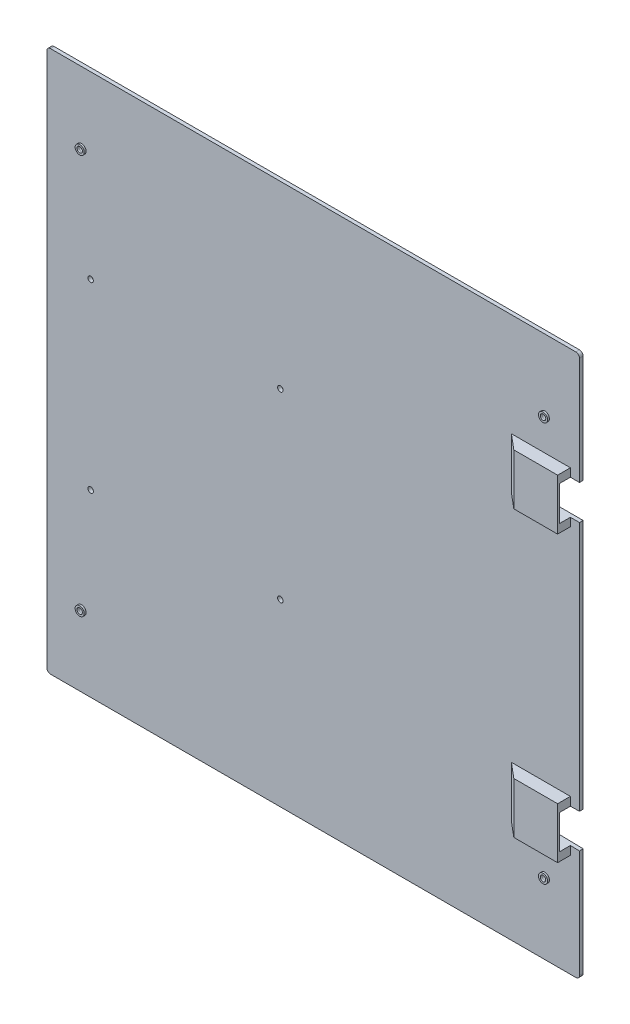
from build123d import *

# Parameters (mm, degrees)
BOSS_EXTRUDE1_DEPTH = 2
SKETCH4_R           = 1.6
CUT_EXTRUDE4_DEPTH  = 414.677410551
SKETCH3_R           = 2.5
SKETCH3_R_2         = 1.5
BOSS_EXTRUDE3_DEPTH = 1
SKETCH5_W           = 24
SKETCH5_H           = 28
BOSS_EXTRUDE2_DEPTH = 7
SKETCH2_W           = 19
SKETCH2_H           = 24.51763809
CUT_EXTRUDE5_DEPTH  = 9
BOSS_EXTRUDE4_REACH = 375.267
SKETCH8_W           = 28
SKETCH8_H           = 24
SKETCH9_R           = 1.5
CUT_EXTRUDE7_DEPTH  = 414.770467772


with BuildPart() as part:
    # Sketch1 → Boss-Extrude1 (new body)
    with BuildSketch(Plane.XY):
        with BuildLine():
            Line((0, 2), (288, 2))
            ThreePointArc((288, 2), (289.414213562, 1.414213562), (290, 0))
            Line((290, 0), (290, -293))
            ThreePointArc((290, -293), (289.414213562, -294.414213562), (288, -295))
            Line((288, -295), (0, -295))
            ThreePointArc((0, -295), (-1.414213562, -294.414213562), (-2, -293))
            Line((-2, -293), (-2, 0))
            ThreePointArc((-2, 0), (-1.414213562, 1.414213562), (0, 2))
        make_face()
    extrude(amount=BOSS_EXTRUDE1_DEPTH)

    # Sketch4 → Cut-Extrude4 (cut, through all)
    with BuildSketch(Plane(origin=(0, 0, 0), x_dir=(-1, 0, 0), z_dir=(0, 0, -1))):
        with Locations((-271, -256)):
            Circle(SKETCH4_R)
        with Locations(Location((-271, -37, 0), (0, 0, 180))):
            Circle(SKETCH4_R)
        with Locations(Location((-17, -256, 0), (0, 0, 180))):
            Circle(SKETCH4_R)
        with Locations((-17, -37)):
            Circle(SKETCH4_R)
    extrude(amount=-CUT_EXTRUDE4_DEPTH, mode=Mode.SUBTRACT)

    # Sketch3 → Boss-Extrude3 (add)
    # profile 1 of 4: a face of its own
    with BuildSketch(Plane(origin=(0, 0, 2), x_dir=(-1, 0, 0), z_dir=(0, 0, -1))):
        with Locations((-271, -37)):
            Circle(SKETCH3_R)
        with Locations((-271, -37)):
            Circle(SKETCH3_R_2, mode=Mode.SUBTRACT)
    # profile 2 of 4: a face of its own
    with BuildSketch(Plane(origin=(0, 0, 2), x_dir=(-1, 0, 0), z_dir=(0, 0, -1))):
        with Locations(Location((-17, -37, 0), (0, 0, 180))):
            Circle(SKETCH3_R)
        with Locations(Location((-17, -37, 0), (0, 0, 180))):
            Circle(SKETCH3_R_2, mode=Mode.SUBTRACT)
    # profile 3 of 4: a face of its own
    with BuildSketch(Plane(origin=(0, 0, 2), x_dir=(-1, 0, 0), z_dir=(0, 0, -1))):
        with Locations((-17, -256)):
            Circle(SKETCH3_R)
        with Locations((-17, -256)):
            Circle(SKETCH3_R_2, mode=Mode.SUBTRACT)
    # profile 4 of 4: a face of its own
    with BuildSketch(Plane(origin=(0, 0, 2), x_dir=(-1, 0, 0), z_dir=(0, 0, -1))):
        with Locations(Location((-271, -256, 0), (0, 0, 180))):
            Circle(SKETCH3_R)
        with Locations(Location((-271, -256, 0), (0, 0, 180))):
            Circle(SKETCH3_R_2, mode=Mode.SUBTRACT)
    extrude(amount=-BOSS_EXTRUDE3_DEPTH)

    # Sketch5 → Boss-Extrude2 (add)
    with BuildSketch(Plane.XY.offset(2)):
        with Locations((273, -68.5)):
            Rectangle(SKETCH5_W, SKETCH5_H)
        with Locations((273, -224.5)):
            Rectangle(SKETCH5_W, SKETCH5_H)
    extrude(amount=BOSS_EXTRUDE2_DEPTH)

    # Sketch2 → Cut-Extrude5 (cut)
    with BuildSketch(Plane(origin=(19.360490202, 0, -72.51763809), x_dir=(0, -1, 0), z_dir=(-0.25881904510252135, 0, 0.9659258262890681))):
        Polygon((234, 285.704276061), (215, 285.704276061), (215.5, 261.186637971), (233.5, 261.186637971), align=None)
        with Locations((68.5, 273.445457016)):
            Rectangle(SKETCH2_W, SKETCH2_H)
    extrude(amount=CUT_EXTRUDE5_DEPTH, mode=Mode.SUBTRACT)

    # Sketch8 → Boss-Extrude4 (add, up to next)
    with BuildSketch(Plane(origin=(103.407277926, 0, -123.235994969), x_dir=(0, -1, 0), z_dir=(-0.6427876096865406, 0, 0.7660444431189771)), mode=Mode.PRIVATE) as boss_extrude4_sk1:
        with Locations((68.5, 193.722688141)):
            Rectangle(SKETCH8_W, SKETCH8_H)
    boss_extrude4_tool1 = extrude(boss_extrude4_sk1.sketch, amount=-BOSS_EXTRUDE4_REACH, mode=Mode.PRIVATE) - part.part
    # Sketch8 → Boss-Extrude4 (add, up to next)
    with BuildSketch(Plane(origin=(103.407277926, 0, -123.235994969), x_dir=(0, -1, 0), z_dir=(-0.6427876096865406, 0, 0.7660444431189771)), mode=Mode.PRIVATE) as boss_extrude4_sk2:
        with Locations((224.5, 193.722688141)):
            Rectangle(SKETCH8_W, SKETCH8_H)
    boss_extrude4_tool2 = extrude(boss_extrude4_sk2.sketch, amount=-BOSS_EXTRUDE4_REACH, mode=Mode.PRIVATE) - part.part
    add(boss_extrude4_tool1.solids().sort_by_distance((251.807467, -68.5, 1.286549))[0])
    add(boss_extrude4_tool2.solids().sort_by_distance((251.807467, -224.5, 1.286549))[0])

    # Sketch9 → Cut-Extrude7 (cut, through all)
    with BuildSketch(Plane(origin=(0, 0, 0), x_dir=(-1, 0, 0), z_dir=(0, 0, -1))):
        with Locations((-126, -196.5)):
            Circle(SKETCH9_R)
        with Locations((-126, -96.5)):
            Circle(SKETCH9_R)
        with Locations((-22, -96.5)):
            Circle(SKETCH9_R)
        with Locations((-22, -196.5)):
            Circle(SKETCH9_R)
    extrude(amount=-CUT_EXTRUDE7_DEPTH, mode=Mode.SUBTRACT)


solid = part.part
